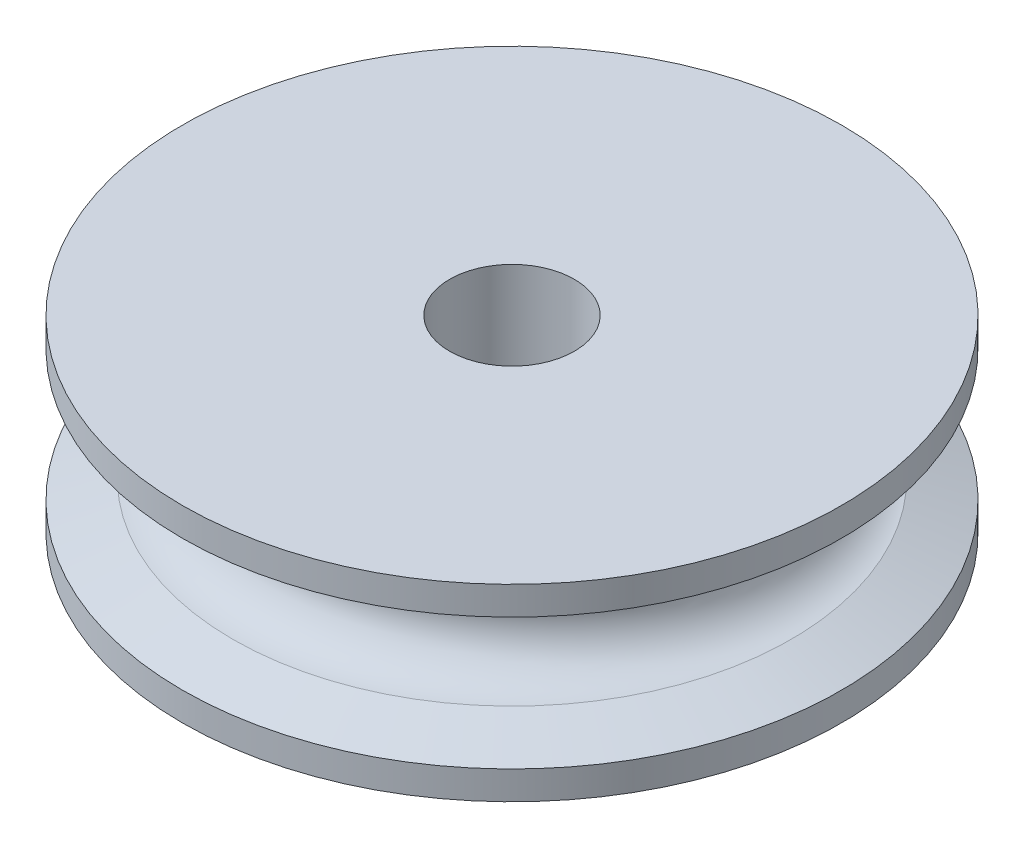
from build123d import *

# Parameters (mm, degrees)
SKETCH1_R           = 14
SKETCH1_R_2         = 2.65
BOSS_EXTRUDE1_DEPTH = 6
CUT_EXTRUDE1_START  = -4
SKETCH2_R           = 14
SKETCH2_R_2         = 10
CUT_EXTRUDE1_DEPTH  = 4
SKETCH3_R           = 14
SKETCH3_R_2         = 2.65
BOSS_EXTRUDE2_DEPTH = 2
FILLET1_R           = 2


with BuildPart() as part:
    # Sketch1 → Boss-Extrude1 (new body)
    with BuildSketch(Plane(origin=(0, 0, 0), x_dir=(1, 0, 0), z_dir=(0, 1, 0))):
        with Locations(Location((0, 0, 0), (0, 0, 270))):
            Circle(SKETCH1_R)
        with Locations(Location((0, 0, 0), (0, 0, 270))):
            Circle(SKETCH1_R_2, mode=Mode.SUBTRACT)
    extrude(amount=BOSS_EXTRUDE1_DEPTH)

    # Sketch2 → Cut-Extrude1 (cut)
    with BuildSketch(Plane(origin=(0, 6, 0), x_dir=(1, 0, 0), z_dir=(0, 1, 0)).offset(CUT_EXTRUDE1_START)):
        with Locations(Location((0, 0, 0), (0, 0, 270))):
            Circle(SKETCH2_R)
        with Locations(Location((0, 0, 0), (0, 0, 270))):
            Circle(SKETCH2_R_2, mode=Mode.SUBTRACT)
    extrude(amount=CUT_EXTRUDE1_DEPTH, mode=Mode.SUBTRACT)

    # Sketch3 → Boss-Extrude2 (add)
    with BuildSketch(Plane(origin=(0, 6, 0), x_dir=(1, 0, 0), z_dir=(0, 1, 0))):
        with Locations(Location((0, 0, 0), (0, 0, 270))):
            Circle(SKETCH3_R)
        with Locations(Location((0, 0, 0), (0, 0, 270))):
            Circle(SKETCH3_R_2, mode=Mode.SUBTRACT)
    extrude(amount=BOSS_EXTRUDE2_DEPTH)

    # Fillet1
    fillet1_edges = [part.edges().sort_by_distance(p)[0] for p in [
        (0, 2, -10),
        (0, 6, -10),
    ]]
    fillet(fillet1_edges, radius=FILLET1_R - 0.0001)  # a hair under: the kernel refuses the full size

    # Chamfer1: read off the stored shape, not the designer's step
    # Chamfer1 outline → Chamfer1 (revolve, cut)
    with BuildSketch(Plane.XY):
        Polygon((11.858584332, 5.994994138), (12, 5.994994138), (12, 6), (14, 6), (14, 6.792991793), align=None)
        Polygon((12, 2.005005862), (11.858584332, 2.005005862), (14, 1.207008207), (14, 2), (12, 2), align=None)
    revolve(axis=Axis((0, 0, 0), (0, 1, 0)), mode=Mode.SUBTRACT)


solid = part.part
